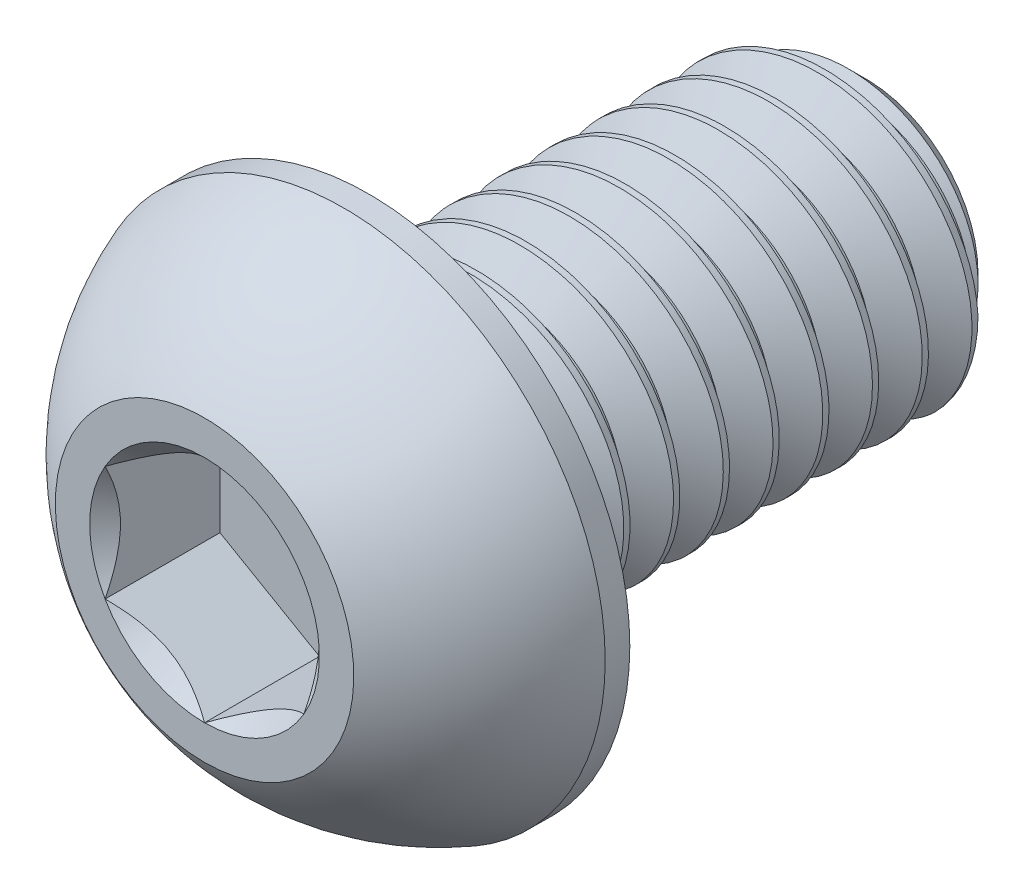
from build123d import *

# Parameters (mm, degrees)
CUT_EXTRUDE2_DEPTH = 2.31
CUT_SWEEP2_PITCH   = 1
CUT_SWEEP2_TO      = 10


with BuildPart() as part:
    # Sketch10 → Revolve3 (revolve)
    with BuildSketch(Plane(origin=(0, 0, 0), x_dir=(0, 0, -1), z_dir=(1, 0, 0)), mode=Mode.PRIVATE) as revolve3_sk:
        Polygon((12.55, 3), (13.3, 2.25), (13.3, 0), (3.3, 0), (3.3, 3), align=None)
    revolve(revolve3_sk.sketch.rotate(Axis((0, 0, 0), (0, 0, -1)), 90), axis=Axis((0, 0, 0), (0, 0, -1)))

    # Sketch7 → Revolve2 (revolve)
    with BuildSketch(Plane(origin=(0, 0, 0), x_dir=(0, 0, -1), z_dir=(1, 0, 0)), mode=Mode.PRIVATE) as revolve2_sk:
        with BuildLine():
            Line((2.805, 5.25), (3.3, 5.25))
            Line((3.3, 5.25), (3.3, 0))
            Line((3.3, 0), (0, 0))
            Line((0, 0), (0, 3))
            ThreePointArc((0, 3), (1.216479019, 4.356906156), (2.805, 5.25))
        make_face()
    revolve(revolve2_sk.sketch.rotate(Axis((0, 0, 0), (0, 0, -1)), 180), axis=Axis((0, 0, 0), (0, 0, -1)))

    # Sketch5 → Cut-Extrude2 (cut)
    with BuildSketch(Plane.XY):
        Polygon((2, -1.154700538), (2, 1.154700538), (0, 2.309401077), (-2, 1.154700538), (-2, -1.154700538), (0, -2.309401077), align=None)
    extrude(amount=-CUT_EXTRUDE2_DEPTH, mode=Mode.SUBTRACT)

    # Cut-Extrude3 cone 1 section (through the dimple's axis) → Cut-Extrude3 (revolve, cut)
    with BuildSketch(Plane(origin=(0, 0, 0), x_dir=(0, -1, 0), z_dir=(1, 0, 0))):
        Polygon((0, 0), (2.309401077, 0), (0, 2.309401077), align=None)
    revolve(axis=Axis((0, 0, 0), (0, 0, -1)), mode=Mode.SUBTRACT)


with BuildPart() as body_2:
    # Split1: read off the stored shape, not the designer's step
    # Split1: the piece on the far side of the plane
    add(part.part)
    split(bisect_by=Plane.XY.offset(-3.3), keep=Keep.BOTTOM)

    # Cut-Sweep2: arcs per turn and ends read off the stored shape
    # Cut-Sweep2: the profile of Sketch12 screwed along a right-hand helix through 15 turns, 8 arcs to a turn; built about Z, then put on its axis
    cut_sweep2_z = Axis((0, 0, 0), (0, 0, 1))
    cut_sweep2_corners = [(2.350480947, 0, -0.375), (2.350480947, 0, -0.5), (3.054126588, 0, -0.90625), (3.054126588, 0, 0.03125)]
    with BuildLine(mode=Mode.PRIVATE) as cut_sweep2_profile:
        Line(cut_sweep2_corners[0], cut_sweep2_corners[1])
        Line(cut_sweep2_corners[1], cut_sweep2_corners[2])
        Line(cut_sweep2_corners[2], cut_sweep2_corners[3])
        Line(cut_sweep2_corners[3], cut_sweep2_corners[0])
    cut_sweep2_cap = Face(cut_sweep2_profile.wire())
    cut_sweep2_turn_angles = [0, 22.5, 45, 67.5, 90, 112.5, 135, 157.5, 180, 202.5, 225, 247.5, 270, 292.5, 315, 337.5, 360]
    cut_sweep2_turn_weights = [1, 0.9238795325112867, 1, 0.9238795325112867, 1, 0.9238795325112867, 1, 0.9238795325112867, 1, 0.9238795325112867, 1, 0.9238795325112867, 1, 0.9238795325112867, 1, 0.9238795325112867, 1]
    cut_sweep2_turn_rails = [Edge.make_bspline([Vector(p[0], p[1], 0).rotate(cut_sweep2_z, cut_sweep2_turn_angles[k]) / cut_sweep2_turn_weights[k] + Vector(0, 0, p[2] + CUT_SWEEP2_PITCH * cut_sweep2_turn_angles[k] / 360) for k in range(17)], [0, 0, 0, 1, 1, 2, 2, 3, 3, 4, 4, 5, 5, 6, 6, 7, 7, 8, 8, 8], 2, cut_sweep2_turn_weights) for p in cut_sweep2_corners]
    cut_sweep2_turn_sides = [Face.make_surface_from_curves(cut_sweep2_turn_rails[p[0]], cut_sweep2_turn_rails[p[1]]) for p in [(0, 1), (1, 2), (2, 3), (3, 0)]]
    cut_sweep2 = Plane(origin=(0, 0, -13.3), x_dir=(0, 1, 0), z_dir=(0, 0, 1)) * split(Solid(Shell([*[p.moved(Location((0, 0, CUT_SWEEP2_PITCH * i))) for i in range(15) for p in cut_sweep2_turn_sides], cut_sweep2_cap, cut_sweep2_cap.rotate(cut_sweep2_z, 5400).moved(Location((0, 0, CUT_SWEEP2_PITCH * 5400 / 360)))])), bisect_by=Plane.XY.offset(CUT_SWEEP2_TO), keep=Keep.BOTTOM, mode=Mode.PRIVATE)
    add(cut_sweep2, mode=Mode.SUBTRACT)


with BuildPart() as part_1:
    add(part.part)

    # Split1
    split(bisect_by=Plane.XY.offset(-3.3), keep=Keep.TOP)

    add(body_2.part)  # Boss-Extrude1 merges body 2
    # Boss-Extrude1: read off the stored shape, not the designer's step
    # Boss-Extrude1 outline → Boss-Extrude1 (revolve)
    with BuildSketch(Plane.XZ):
        Polygon((2.350480947, -3.3), (2.350480947, -3.949519053), (3, -3.3), align=None)
    revolve(axis=Axis((0, 0, 0), (0, 0, 1)))


solid = part_1.part
